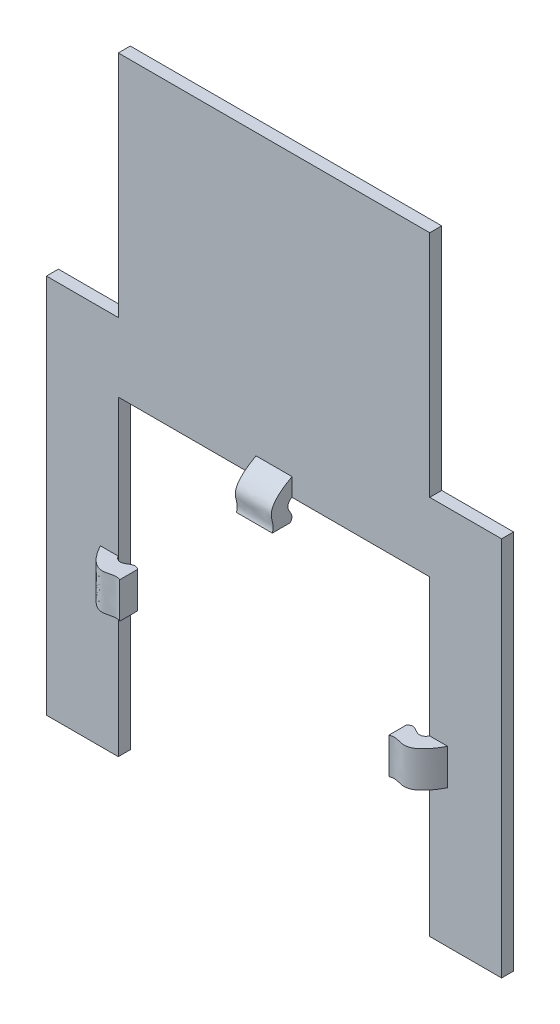
from build123d import *

# Parameters (mm, degrees)
BOSS_EXTRUDE1_DEPTH = 1
BOSS_EXTRUDE2_START = -1.5
BOSS_EXTRUDE2_DEPTH = 3
CIRPATTERN1_COUNT   = 3
CIRPATTERN1_ANGLE   = 180


# Read off the part's stored shape, not the designer's step: Boss-Extrude2
with BuildPart() as part:
    # Sketch1 → Boss-Extrude1 (new body)
    with BuildSketch(Plane.XY):
        Polygon((13, -9.565), (13, 9.565), (-13, 9.565), (-13, -9.565), (-19, -9.565), (-19, -41.315), (-13, -41.315), (-13, -15.315), (13, -15.315), (13, -41.315), (19, -41.315), (19, -9.565), align=None)
    extrude(amount=BOSS_EXTRUDE1_DEPTH)

    # Boss-Extrude2 outline → Boss-Extrude2 (add)
    with BuildSketch(Plane(origin=(0, -28.315, 0), x_dir=(-1, 0, 0), z_dir=(0, -1, 0)).offset(BOSS_EXTRUDE2_START)):
        with BuildLine():
            Line((-11.23522271, -2.644286359), (-11.23522271, -1.144286359))
            add(Edge.make_bspline(
                [(-11.23522271, -1.144286359), (-11.740174878, -0.757764956), (-12.028679887, -1.161534837), (-12.227869222, -1.503002268), (-12.747184273, -1.488774458), (-13, -1)],
                knots=[0, 0, 0, 0, 0, 0, 1, 1, 1, 1, 1, 1], degree=5))
            Line((-13, -1), (-14.5, -1))
            add(Edge.make_bspline(
                [(-14.5, -1), (-13.760887065, -2.414906572), (-12.67824158, -3.40768712), (-12.345095428, -2.525951835), (-11.7215069, -2.450856602), (-11.23522271, -2.644286359)],
                knots=[0, 0, 0, 0, 0, 0, 1, 1, 1, 1, 1, 1], degree=5))
        make_face()
    boss_extrude2 = extrude(amount=BOSS_EXTRUDE2_DEPTH)

    # CirPattern1: Boss-Extrude2 ×3 about axis
    cirpattern1_axis = Axis((0, -28.315, 1.05), (0, 0, 1))
    for i in range(1, CIRPATTERN1_COUNT):
        add(boss_extrude2.rotate(cirpattern1_axis, i * CIRPATTERN1_ANGLE / (CIRPATTERN1_COUNT - 1)))


solid = part.part
